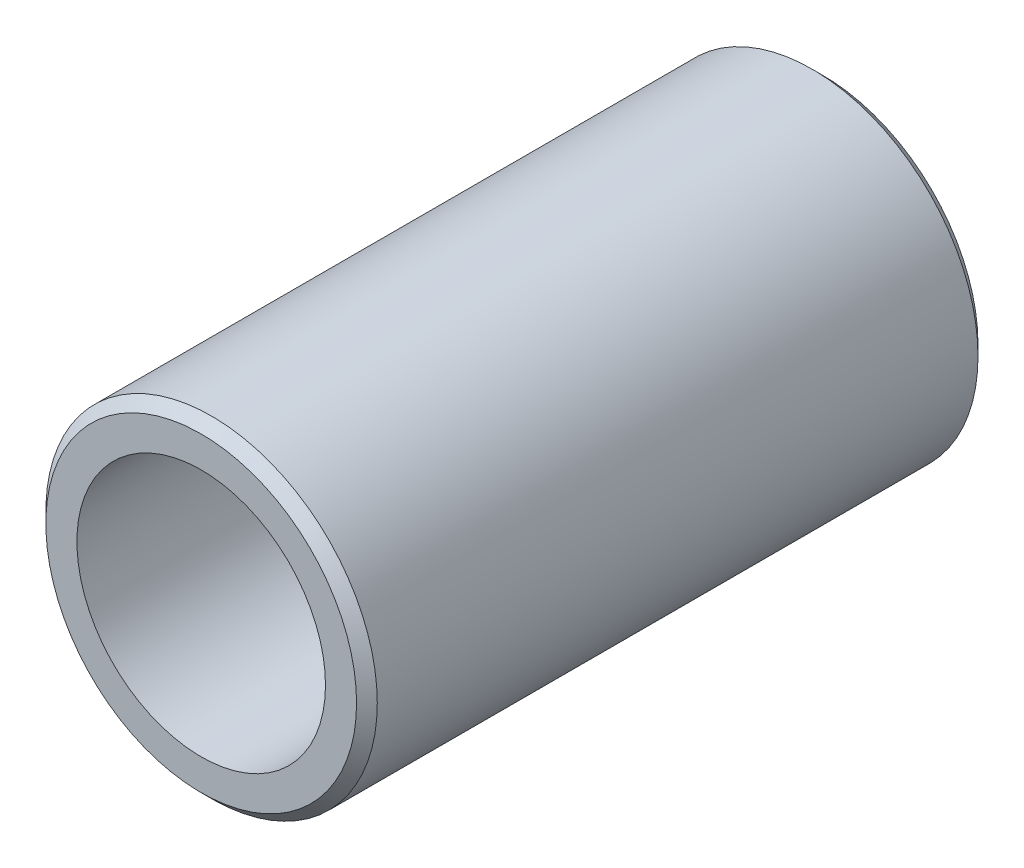
from build123d import *

# Parameters (mm, degrees)
SKETCH1_R           = 8
SKETCH1_R_2         = 6
EXTRUDE_THIN1_DEPTH = 30
CHAMFER1_SIZE       = 0.5


with BuildPart() as part:
    # Sketch1 → Extrude-Thin1 (new body)
    with BuildSketch(Plane.XY):
        Circle(SKETCH1_R)
        Circle(SKETCH1_R_2, mode=Mode.SUBTRACT)
    extrude(amount=EXTRUDE_THIN1_DEPTH)

    # Chamfer1
    chamfer1_edges = [part.edges().sort_by_distance(p)[0] for p in [
        (-8, 0, 0),
        (-8, 0, 30),
    ]]
    chamfer(chamfer1_edges, length=CHAMFER1_SIZE)


solid = part.part
